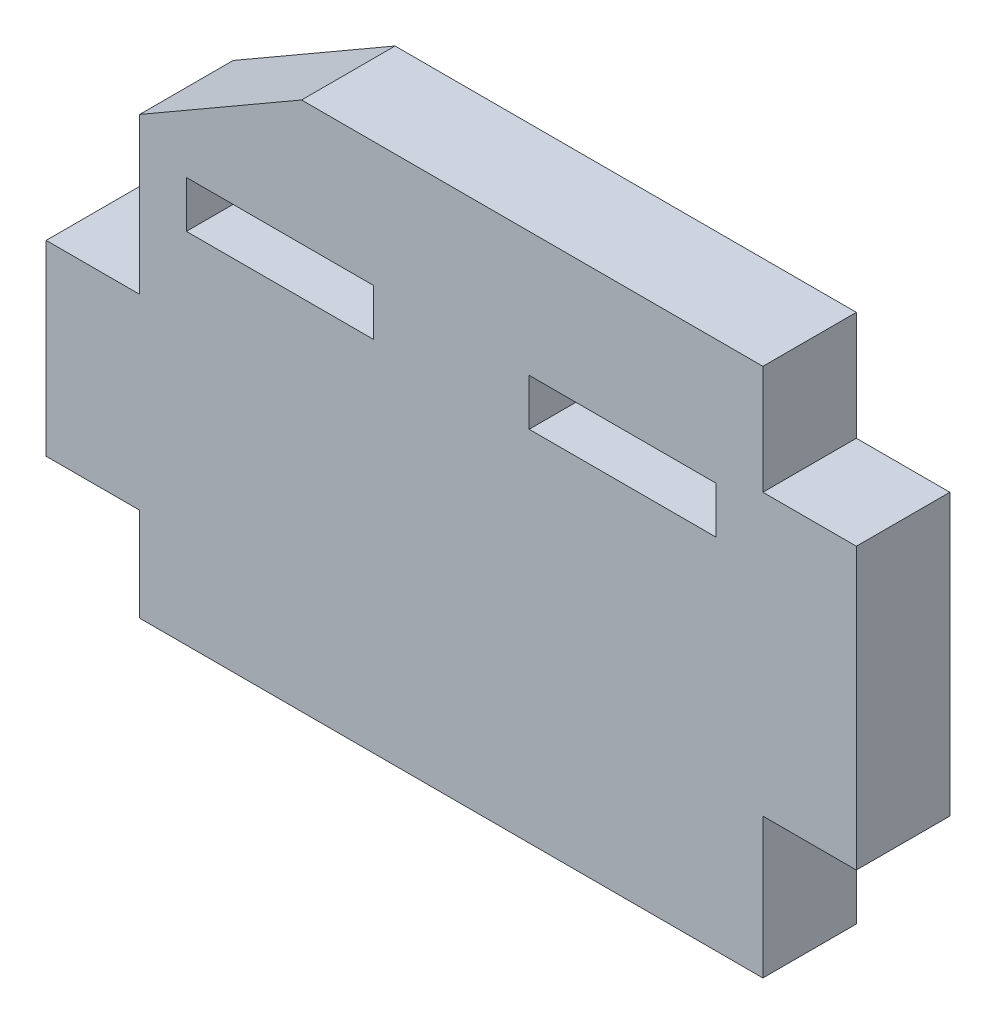
from build123d import *

# Parameters (mm, degrees)
ESQUISSE1_W                  = 52
ESQUISSE1_H                  = 34
BOSS_EXTRU_1_DEPTH           = 6
ESQUISSE2_W                  = 6
ESQUISSE2_H                  = 7
ESQUISSE2_H_2                = 9
ESQUISSE2_H_3                = 16
ESQUISSE2_H_4                = 6
ENL_V_MAT_EXTRU_1_DEPTH      = 63.417946137
ENL_V_MAT_EXTRU_2_DEPTH      = 63.417946137
ENL_V_MAT_EXTRU_2_DEPTH_BACK = 63.417946137
ESQUISSE3_W                  = 12
ESQUISSE3_H                  = 3
CHANFREIN1_SIZE              = 6
CHANFREIN1_SIZE2             = 10.392304845


with BuildPart() as part:
    # Esquisse1 → Boss.-Extru.1 (new body)
    with BuildSketch(Plane.XY):
        with Locations((26, 17)):
            Rectangle(ESQUISSE1_W, ESQUISSE1_H)
    extrude(amount=BOSS_EXTRU_1_DEPTH)

    # Esquisse2 → Enlèv. mat.-Extru.1 (cut, through all)
    with BuildSketch(Plane.XY.offset(6)):
        with Locations((49, 30.5)):
            Rectangle(ESQUISSE2_W, ESQUISSE2_H)
        with Locations((49, 4.5)):
            Rectangle(ESQUISSE2_W, ESQUISSE2_H_2)
        with Locations((3, 26)):
            Rectangle(ESQUISSE2_W, ESQUISSE2_H_3)
        with Locations((3, 3)):
            Rectangle(ESQUISSE2_W, ESQUISSE2_H_4)
    extrude(amount=-ENL_V_MAT_EXTRU_1_DEPTH, mode=Mode.SUBTRACT)

    # Esquisse3 → Enlèv. mat.-Extru.2 (cut, two sides: drawn at the far end of the back side and taken through both)
    with BuildSketch(Plane.XY.offset(6).offset(-ENL_V_MAT_EXTRU_2_DEPTH_BACK)):
        with Locations((15, 24.5)):
            Rectangle(ESQUISSE3_W, ESQUISSE3_H)
        with Locations((37, 24.5)):
            Rectangle(ESQUISSE3_W, ESQUISSE3_H)
    extrude(amount=ENL_V_MAT_EXTRU_2_DEPTH + ENL_V_MAT_EXTRU_2_DEPTH_BACK, mode=Mode.SUBTRACT)

    # Chanfrein1
    chanfrein1_edges = [part.edges().sort_by_distance(p)[0] for p in [
        (6, 34, 3),
    ]]
    chanfrein1_side = [part.faces().sort_by_distance(p)[0] for p in [
        (6, 26, 3),
    ]]
    chamfer(chanfrein1_edges, length=CHANFREIN1_SIZE, length2=CHANFREIN1_SIZE2, reference=chanfrein1_side[0])


solid = part.part
